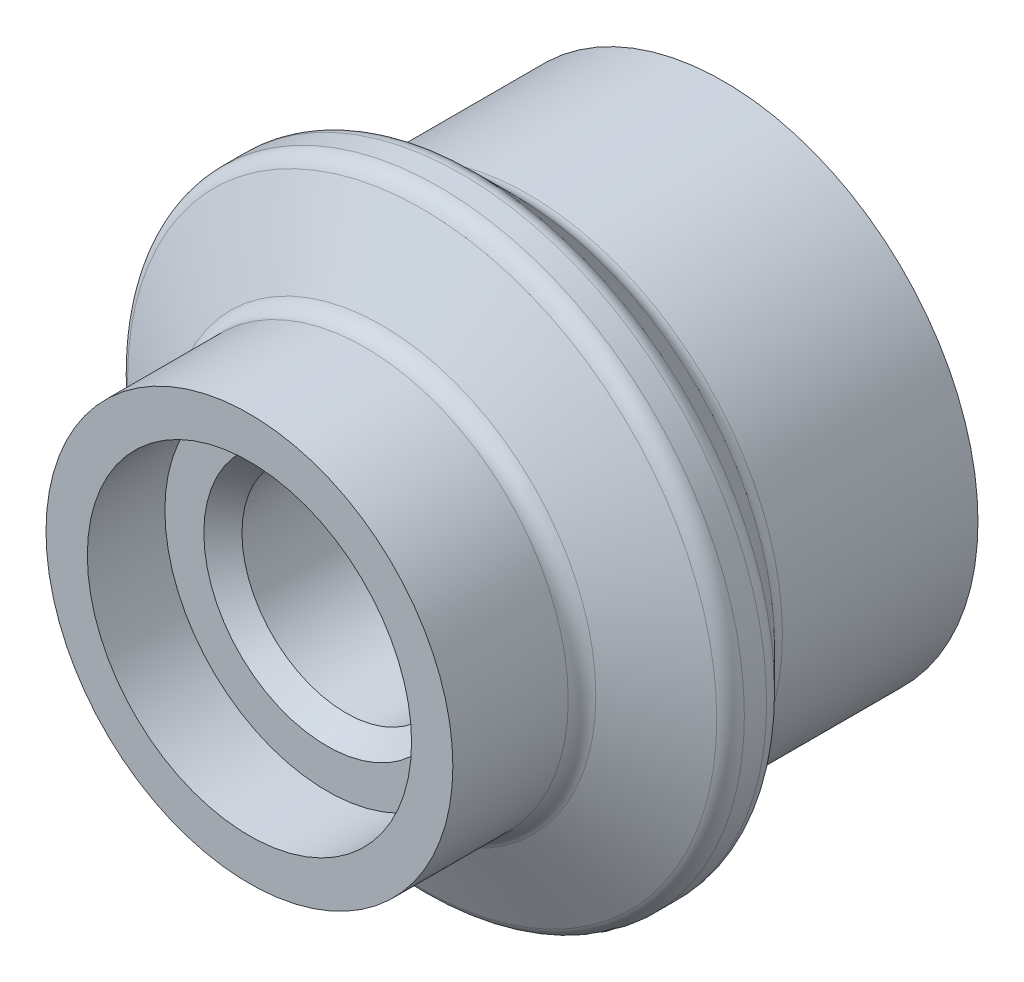
from build123d import *

# Parameters (mm, degrees)
SKETCH1_R           = 21
SKETCH1_R_2         = 8.1875
BOSS_EXTRUDE1_DEPTH = 37.3
SKETCH2_R           = 24
SKETCH2_R_2         = 21
BOSS_EXTRUDE2_DEPTH = 27.3
SKETCH3_R           = 12.75
CUT_EXTRUDE1_DEPTH  = 6.1
SKETCH4_R           = 11.5
CUT_EXTRUDE2_DEPTH  = 2
MOVE_FACE2_BY       = 5
SKETCH6_R           = 24
SKETCH6_R_2         = 20
CUT_EXTRUDE3_DEPTH  = 20
CHAMFER1_SIZE2      = 4
CHAMFER1_SIZE       = 8
CHAMFER2_SIZE       = 1.5
CHAMFER3_SIZE       = 4


with BuildPart() as part:
    # Sketch1 → Boss-Extrude1 (new body)
    with BuildSketch(Plane.XY):
        Circle(SKETCH1_R)
        Circle(SKETCH1_R_2, mode=Mode.SUBTRACT)
    extrude(amount=BOSS_EXTRUDE1_DEPTH)

    # Sketch2 → Boss-Extrude2 (add)
    with BuildSketch(Plane(origin=(0, 0, 0), x_dir=(-1, 0, 0), z_dir=(0, 0, -1))):
        Circle(SKETCH2_R)
        with Locations(Location((0, 0, 0), (0, 0, 180))):
            Circle(SKETCH2_R_2, mode=Mode.SUBTRACT)
    extrude(amount=-BOSS_EXTRUDE2_DEPTH)

    # Sketch3 → Cut-Extrude1 (cut)
    with BuildSketch(Plane.XY.offset(37.3)):
        Circle(SKETCH3_R)
    extrude(amount=-CUT_EXTRUDE1_DEPTH, mode=Mode.SUBTRACT)

    # Sketch4 → Cut-Extrude2 (cut)
    with BuildSketch(Plane(origin=(0, 0, 0), x_dir=(-1, 0, 0), z_dir=(0, 0, -1))):
        Circle(SKETCH4_R)
    extrude(amount=-CUT_EXTRUDE2_DEPTH, mode=Mode.SUBTRACT)

    # Move Face2: a curved face moved inward by 5.0
    add(Solid.thicken(part.faces().sort_by_distance((-21, 0, 32.3))[0], -MOVE_FACE2_BY), mode=Mode.SUBTRACT)

    # Sketch6 → Cut-Extrude3 (cut)
    with BuildSketch(Plane(origin=(0, 0, 0), x_dir=(-1, 0, 0), z_dir=(0, 0, -1))):
        Circle(SKETCH6_R)
        Circle(SKETCH6_R_2, mode=Mode.SUBTRACT)
    extrude(amount=-CUT_EXTRUDE3_DEPTH, mode=Mode.SUBTRACT)

    # Chamfer1
    chamfer1_edges = [part.edges().sort_by_distance(p)[0] for p in [
        (24, 0, 27.3),
    ]]
    chamfer1_side = [part.faces().sort_by_distance(p)[0] for p in [
        (23.92, 0, 27.3),
    ]]
    chamfer(chamfer1_edges, length=CHAMFER1_SIZE - 0.0001, length2=CHAMFER1_SIZE2 - 0.0001, reference=chamfer1_side[0])  # a hair under: the kernel refuses the full size

    # Chamfer2
    chamfer2_edges = [part.edges().sort_by_distance(p)[0] for p in [
        (-8.1875, 0, 31.2),
        (-8.1875, 0, 2),
    ]]
    chamfer(chamfer2_edges, length=CHAMFER2_SIZE)

    # Fillet1: read off the stored shape, not the designer's step
    # Fillet1 outline → Fillet1 (revolve, cut)
    with BuildSketch(Plane.XZ):
        with BuildLine():
            ThreePointArc((23.170820393, 23.714589803), (23.775976213, 23.161545685), (24, 22.372949017))
            Line((24, 22.372949017), (24, 23.714589803))
            Line((24, 23.714589803), (23.170820393, 23.714589803))
        make_face()
    revolve(axis=Axis((0, 0, 0), (0, 0, 1)), mode=Mode.SUBTRACT)

    # Fillet1 2 outline → Fillet1 2 (revolve)
    with BuildSketch(Plane.XZ):
        with BuildLine():
            Line((16, 26.885410197), (16.829179607, 26.885410197))
            ThreePointArc((16.829179607, 26.885410197), (16.224023787, 27.438454315), (16, 28.227050983))
            Line((16, 28.227050983), (16, 26.885410197))
        make_face()
    revolve(axis=Axis((0, 0, 0), (0, 0, 1)))

    # Chamfer3
    chamfer3_edges = [part.edges().sort_by_distance(p)[0] for p in [
        (20, 0, 20),
    ]]
    chamfer(chamfer3_edges, length=CHAMFER3_SIZE - 0.0001)  # a hair under: the kernel refuses the full size

    # Fillet3: read off the stored shape, not the designer's step
    # Fillet3 outline → Fillet3 (revolve, cut)
    with BuildSketch(Plane.XZ):
        with BuildLine():
            ThreePointArc((24, 20.621320344), (23.885819299, 20.047295195), (23.560660172, 19.560660172))
            Line((23.560660172, 19.560660172), (24, 19.560660172))
            Line((24, 19.560660172), (24, 20.621320344))
        make_face()
    revolve(axis=Axis((0, 0, 0), (0, 0, 1)), mode=Mode.SUBTRACT)

    # Fillet3 2 outline → Fillet3 2 (revolve)
    with BuildSketch(Plane.XZ):
        with BuildLine():
            ThreePointArc((20, 15.378679656), (20.114180701, 15.952704805), (20.439339828, 16.439339828))
            Line((20.439339828, 16.439339828), (20, 16.439339828))
            Line((20, 16.439339828), (20, 15.378679656))
        make_face()
    revolve(axis=Axis((0, 0, 0), (0, 0, 1)))


solid = part.part
